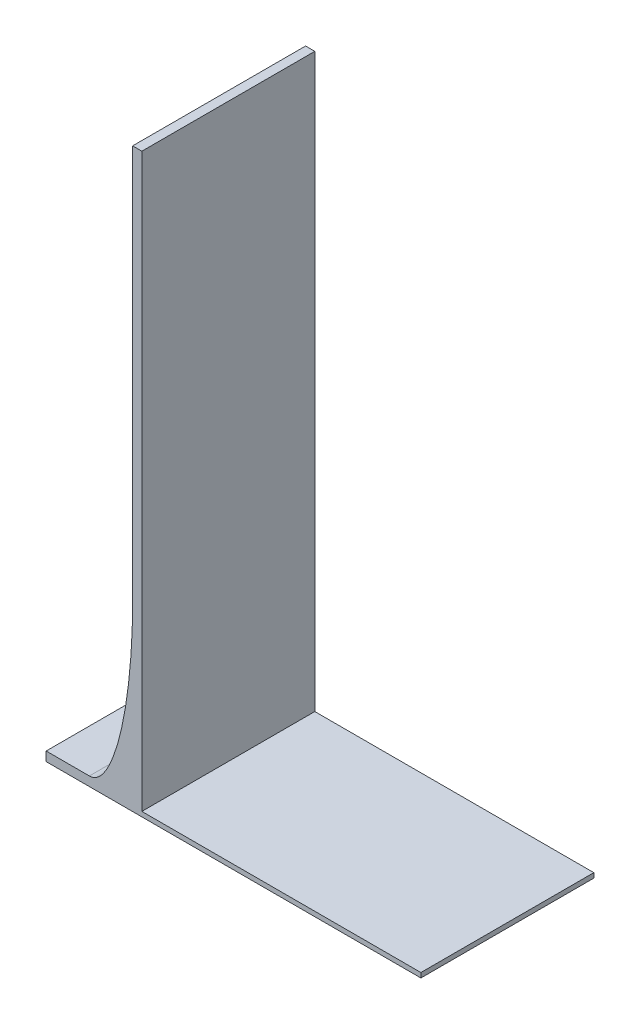
from build123d import *

# Parameters (mm, degrees)
ESQUISSE1_W        = 100
ESQUISSE1_H        = 1.65
EXTRU_MINCE1_DEPTH = 60
EXTRU_MINCE2_DEPTH = 60
CONG_1_SIZE        = 15
CONG_1_SIZE_2      = 60


# Read off the part's stored shape, not the designer's step: Extru.-Mince2
with BuildPart() as part:
    # Esquisse1 → Extru.-Mince1 (new body)
    with BuildSketch(Plane.XY):
        with Locations((50, 0.825)):
            Rectangle(ESQUISSE1_W, ESQUISSE1_H)
    extrude(amount=EXTRU_MINCE1_DEPTH)

    # Extru.-Mince2 outline → Extru.-Mince2 (add)
    with BuildSketch(Plane.XY):
        Polygon((-30, 0), (0, 0), (0, 1.65), (3.2, 1.65), (3.2, 200), (0, 200), (0, 3.2), (-30, 3.2), align=None)
    extrude(amount=EXTRU_MINCE2_DEPTH)

    # Congé1
    # an asymmetric fillet: 60, 15 mm, written as the material it adds along each edge
    with BuildSketch(Plane(origin=(0, 3.2, 0), x_dir=(-1, 0, 0), z_dir=(0, 0, 1))) as cong_1_piece_1:
        with BuildLine():
            Bezier((CONG_1_SIZE, 0), (0, 0), (0, -CONG_1_SIZE_2), weights=[1, 0.707106781, 1])
            Line((0, -CONG_1_SIZE_2), (0, 0))
            Line((0, 0), (CONG_1_SIZE, 0))
        make_face()
    extrude(amount=60)


solid = part.part
